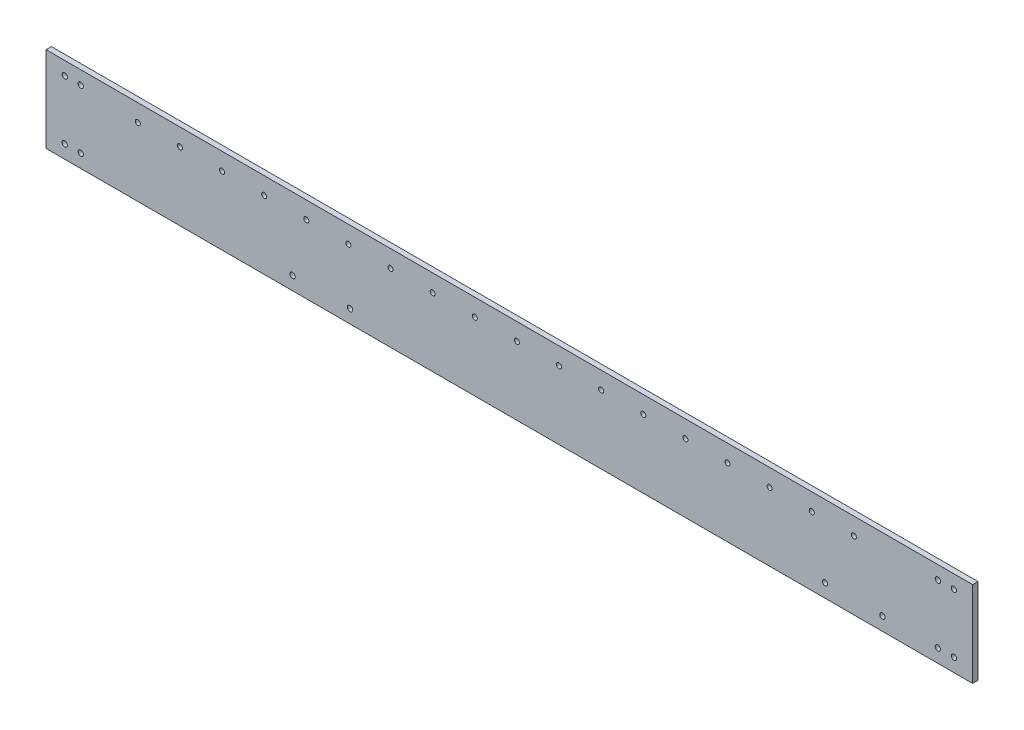
from build123d import *

# Parameters (mm, degrees)
SKETCH1_W                    = 3.175
SKETCH1_H                    = 50.8
BOSS_EXTRUDE1_DEPTH          = 550
SIDEHOLES_SKETCH4_R          = 1.5875
SIDEHOLES_SKETCH4_R_2        = 1.5
SIDEHOLES_CUT_EXTRUDE3_DEPTH = 553.350179347


with BuildPart() as part:
    # Sketch1 → Boss-Extrude1 (new body)
    with BuildSketch(Plane(origin=(0, 0, 0), x_dir=(0, 0, -1), z_dir=(1, 0, 0))):
        with Locations((-1.5875, 25.4)):
            Rectangle(SKETCH1_W, SKETCH1_H)
    extrude(amount=BOSS_EXTRUDE1_DEPTH)

    # SideHoles-Sketch4 → SideHoles-Cut-Extrude3 (cut, through all)
    with BuildSketch(Plane.XY.offset(3.175)):
        with Locations((11.1125, 42.8625)):
            Circle(SIDEHOLES_SKETCH4_R)
        with Locations((529.3625, 42.8625)):
            Circle(SIDEHOLES_SKETCH4_R)
        with Locations((20.6375, 42.8625)):
            Circle(SIDEHOLES_SKETCH4_R)
        with Locations((538.8875, 42.8625)):
            Circle(SIDEHOLES_SKETCH4_R)
        with Locations((11.1125, 7.9375)):
            Circle(SIDEHOLES_SKETCH4_R)
        with Locations((20.6375, 7.9375)):
            Circle(SIDEHOLES_SKETCH4_R)
        with Locations((529.3625, 7.9375)):
            Circle(SIDEHOLES_SKETCH4_R)
        with Locations((538.8875, 7.9375)):
            Circle(SIDEHOLES_SKETCH4_R)
        with Locations((54.5, 40.575)):
            Circle(SIDEHOLES_SKETCH4_R_2)
        with Locations((79.5, 40.575)):
            Circle(SIDEHOLES_SKETCH4_R_2)
        with Locations((104.5, 40.575)):
            Circle(SIDEHOLES_SKETCH4_R_2)
        with Locations((129.5, 40.575)):
            Circle(SIDEHOLES_SKETCH4_R_2)
        with Locations((154.5, 40.575)):
            Circle(SIDEHOLES_SKETCH4_R_2)
        with Locations((179.5, 40.575)):
            Circle(SIDEHOLES_SKETCH4_R_2)
        with Locations((204.5, 40.575)):
            Circle(SIDEHOLES_SKETCH4_R_2)
        with Locations((229.5, 40.575)):
            Circle(SIDEHOLES_SKETCH4_R_2)
        with Locations((254.5, 40.575)):
            Circle(SIDEHOLES_SKETCH4_R_2)
        with Locations((279.5, 40.575)):
            Circle(SIDEHOLES_SKETCH4_R_2)
        with Locations((304.5, 40.575)):
            Circle(SIDEHOLES_SKETCH4_R_2)
        with Locations((329.5, 40.575)):
            Circle(SIDEHOLES_SKETCH4_R_2)
        with Locations((354.5, 40.575)):
            Circle(SIDEHOLES_SKETCH4_R_2)
        with Locations((379.5, 40.575)):
            Circle(SIDEHOLES_SKETCH4_R_2)
        with Locations((496.4875, 7.9375)):
            Circle(SIDEHOLES_SKETCH4_R)
        with Locations((180.4875, 7.9375)):
            Circle(SIDEHOLES_SKETCH4_R)
        with Locations((404.5, 40.575)):
            Circle(SIDEHOLES_SKETCH4_R_2)
        with Locations((429.5, 40.575)):
            Circle(SIDEHOLES_SKETCH4_R_2)
        with Locations((454.5, 40.575)):
            Circle(SIDEHOLES_SKETCH4_R_2)
        with Locations((479.5, 40.575)):
            Circle(SIDEHOLES_SKETCH4_R_2)
        with Locations((146.3625, 7.9375)):
            Circle(SIDEHOLES_SKETCH4_R)
        with Locations((462.3625, 7.9375)):
            Circle(SIDEHOLES_SKETCH4_R)
    extrude(amount=-SIDEHOLES_CUT_EXTRUDE3_DEPTH, mode=Mode.SUBTRACT)


solid = part.part
